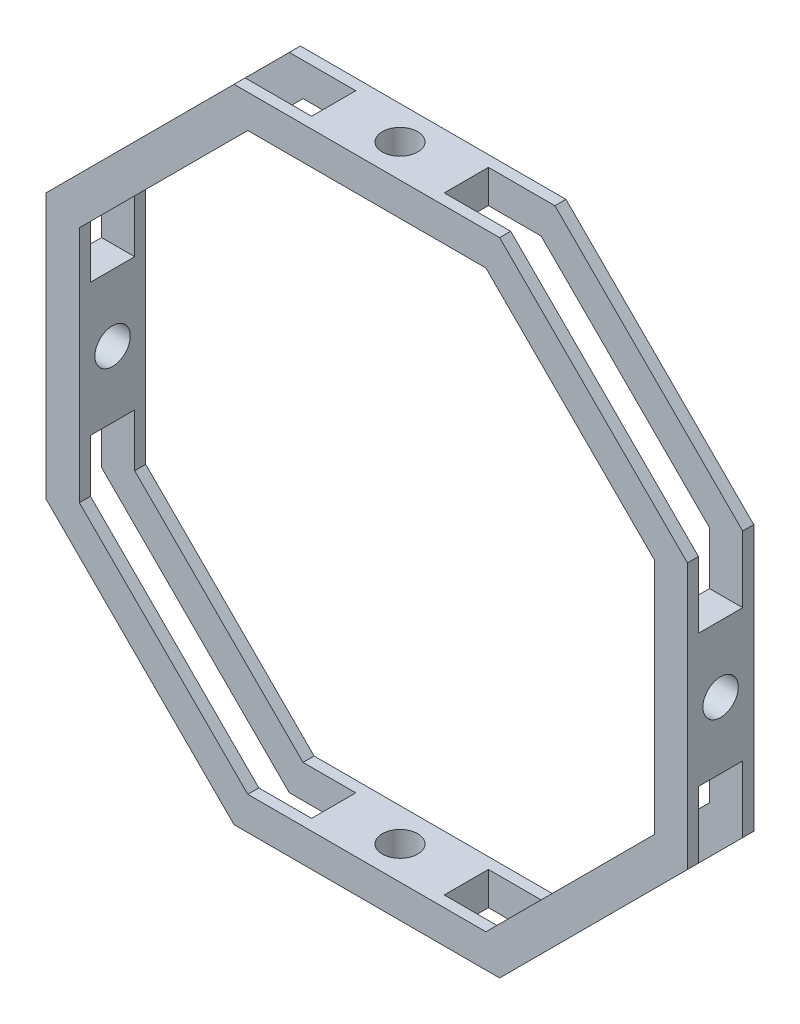
from build123d import *

# Parameters (mm, degrees)
RESSALTO_EXTRUS_O1_DEPTH   = 30
CORTE_EXTRUS_O1_DEPTH      = 326.614803103
CORTE_EXTRUS_O1_DEPTH_BACK = 326.614803103
ESBO_O2_R                  = 8
ESBO_O2_W                  = 20
ESBO_O2_H                  = 30.060966544
CORTE_EXTRUS_O2_DEPTH      = 352.344105256
CORTE_EXTRUS_O2_DEPTH_BACK = 352.344105256
ESBO_O3_W                  = 20
ESBO_O3_H                  = 120.121933088
CORTE_EXTRUS_O3_DEPTH      = 326.614803103
CORTE_EXTRUS_O3_DEPTH_BACK = 326.614803103
ESBO_O5_R                  = 8
CORTE_EXTRUS_O4_DEPTH      = 326.614803103
CORTE_EXTRUS_O4_DEPTH_BACK = 326.614803103
ESBO_O4_W                  = 30.060966544
ESBO_O4_H                  = 20
CORTE_EXTRUS_O5_DEPTH      = 352.344105256
CORTE_EXTRUS_O5_DEPTH_BACK = 352.344105256
ESBO_O7_W                  = 20
ESBO_O7_H                  = 120.121933088


with BuildPart() as part:
    # Esboço1 → Ressalto-extrusão1 (new body)
    with BuildSketch(Plane.XY):
        Polygon((145, 60.060966544), (60.060966544, 145), (-60.060966544, 145), (-145, 60.060966544), (-145, -60.060966544), (-60.060966544, -145), (60.060966544, -145), (145, -60.060966544), align=None)
        Polygon((130, 53.847763109), (53.847763109, 130), (-53.847763109, 130), (-130, 53.847763109), (-130, -53.847763109), (-53.847763109, -130), (53.847763109, -130), (130, -53.847763109), align=None, mode=Mode.SUBTRACT)
    extrude(amount=RESSALTO_EXTRUS_O1_DEPTH)

    # Esboço2 → Corte-extrusão1 (cut, two sides: drawn at the far end of the back side and taken through both)
    with BuildSketch(Plane(origin=(145, 0, 0), x_dir=(0, 0, -1), z_dir=(1, 0, 0)).offset(-CORTE_EXTRUS_O1_DEPTH_BACK)):
        with Locations((-15, 0)):
            Circle(ESBO_O2_R)
        with Locations((-15, 45.030483272)):
            Rectangle(ESBO_O2_W, ESBO_O2_H)
        with Locations((-15, -45.030483272)):
            Rectangle(ESBO_O2_W, ESBO_O2_H)
    extrude(amount=CORTE_EXTRUS_O1_DEPTH + CORTE_EXTRUS_O1_DEPTH_BACK, mode=Mode.SUBTRACT)

    # Esboço3 → Corte-extrusão2 (cut, two sides: drawn at the far end of the back side and taken through both)
    with BuildSketch(Plane(origin=(102.530483272, 102.530483272, 0), x_dir=(0, 0, -1), z_dir=(0.7071067811865469, 0.7071067811865481, 0)).offset(-CORTE_EXTRUS_O2_DEPTH_BACK)):
        with Locations((-15, 0)):
            Rectangle(ESBO_O3_W, ESBO_O3_H)
    extrude(amount=CORTE_EXTRUS_O2_DEPTH + CORTE_EXTRUS_O2_DEPTH_BACK, mode=Mode.SUBTRACT)

    # Esboço5 → Corte-extrusão3 (cut, two sides: drawn at the far end of the back side and taken through both)
    with BuildSketch(Plane(origin=(0, 145, 0), x_dir=(1, 0, 0), z_dir=(0, 1, 0)).offset(-CORTE_EXTRUS_O3_DEPTH_BACK)):
        with Locations((0, -15)):
            Circle(ESBO_O5_R)
    extrude(amount=CORTE_EXTRUS_O3_DEPTH + CORTE_EXTRUS_O3_DEPTH_BACK, mode=Mode.SUBTRACT)

    # Esboço4 → Corte-extrusão4 (cut, two sides: drawn at the far end of the back side and taken through both)
    with BuildSketch(Plane(origin=(0, 145, 0), x_dir=(1, 0, 0), z_dir=(0, 1, 0)).offset(-CORTE_EXTRUS_O4_DEPTH_BACK)):
        with Locations((45.030483272, -15)):
            Rectangle(ESBO_O4_W, ESBO_O4_H)
        with Locations((-45.030483272, -15)):
            Rectangle(ESBO_O4_W, ESBO_O4_H)
    extrude(amount=CORTE_EXTRUS_O4_DEPTH + CORTE_EXTRUS_O4_DEPTH_BACK, mode=Mode.SUBTRACT)

    # Esboço7 → Corte-extrusão5 (cut, two sides: drawn at the far end of the back side and taken through both)
    with BuildSketch(Plane(origin=(-102.530483272, 102.530483272, 0), x_dir=(0, 0, 1), z_dir=(-0.7071067811865479, 0.7071067811865472, 0)).offset(-CORTE_EXTRUS_O5_DEPTH_BACK)):
        with Locations((15, 0)):
            Rectangle(ESBO_O7_W, ESBO_O7_H)
    extrude(amount=CORTE_EXTRUS_O5_DEPTH + CORTE_EXTRUS_O5_DEPTH_BACK, mode=Mode.SUBTRACT)


solid = part.part
